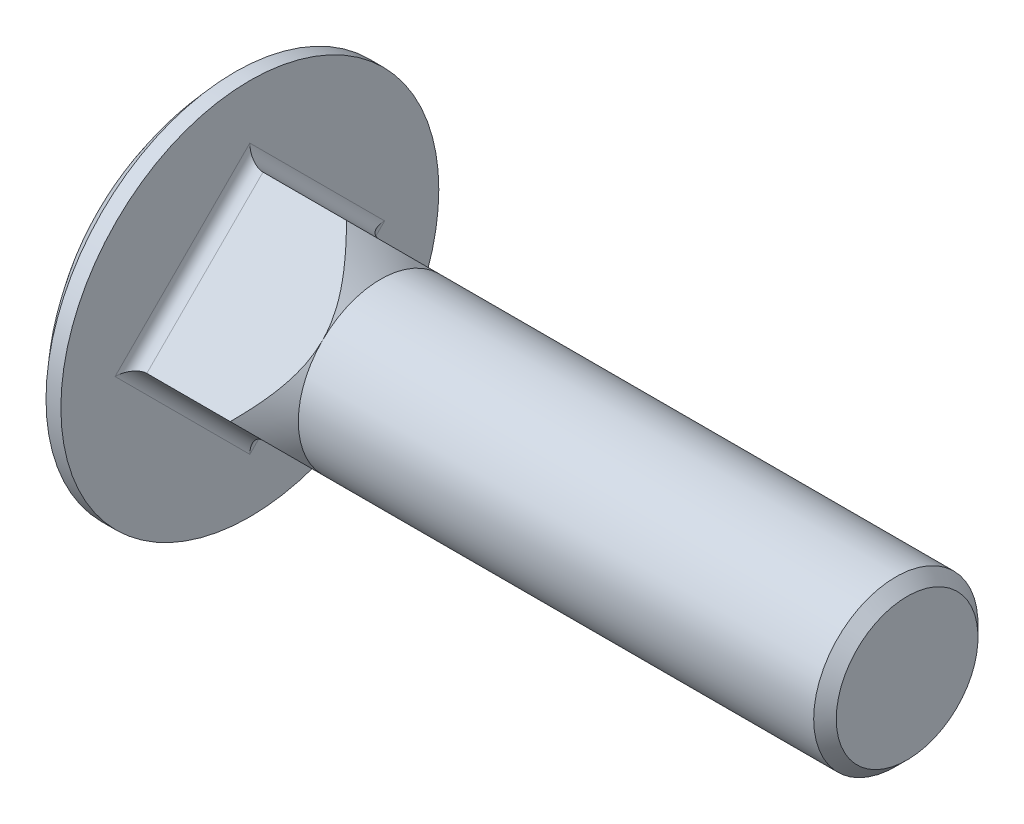
from build123d import *

# Parameters (mm, degrees)
BOSS_EXTRUDE1_DEPTH = 15.9
FILLET1_R           = 1.6


with BuildPart() as part:
    # BodySke → Base-Revolve (revolve)
    with BuildSketch(Plane.XY):
        with BuildLine():
            Line((9.0906, 23), (10.9, 23))
            Line((10.9, 23), (10.9, 10))
            Line((10.9, 10), (89.526, 10))
            Line((89.526, 10), (90.9, 8.626))
            Line((90.9, 8.626), (90.9, 0))
            Line((90.9, 0), (0, 0))
            ThreePointArc((0, 0), (2.355084776, 12.365668283), (9.0906, 23))
        make_face()
    revolve(axis=Axis((-31.75, 0, 0), (1, 0, 0)))

    # Sketch1 → Boss-Extrude1 (add)
    with BuildSketch(Plane(origin=(10.9, 0, 0), x_dir=(0, 0, -1), z_dir=(1, 0, 0))):
        Polygon((0, 14.142135624), (14.142135624, 0), (0, -14.142135624), (-14.142135624, 0), align=None)
    extrude(amount=BOSS_EXTRUDE1_DEPTH)

    # Sketch2 → Cut-Revolve1 (revolve, cut)
    with BuildSketch(Plane.XY):
        Polygon((26.8, 10), (31.8, 10), (31.8, 24), (12.8, 24), align=None)
    revolve(axis=Axis((0, 0, 0), (1, 0, 0)), mode=Mode.SUBTRACT)

    # Fillet1
    fillet1_edges = [part.edges().sort_by_distance(p)[0] for p in [
        (10.9, 7.071067812, 7.071067812),
        (10.9, -7.071067812, 7.071067812),
        (10.9, -7.071067812, -7.071067812),
        (10.9, 7.071067812, -7.071067812),
    ]]
    fillet(fillet1_edges, radius=FILLET1_R)


solid = part.part
